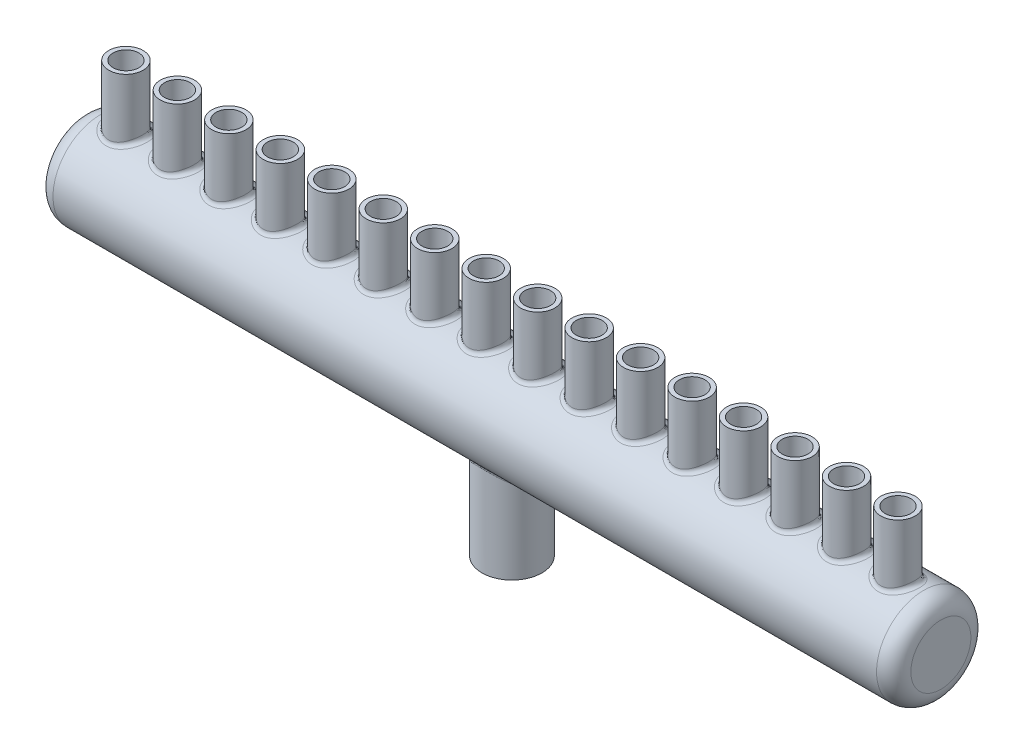
from build123d import *

# Parameters (mm, degrees)
CROQUIS1_R     = 11
EXTRUIR1_DEPTH = 100
CROQUIS2_R     = 7
EXTRUIR2_DEPTH = 30
CROQUIS3_R     = 4
EXTRUIR3_DEPTH = 25
REDONDEO1_R    = 4
REDONDEO2_R    = 1
VACIADO1_T     = -1


with BuildPart() as part:
    # Croquis1 → Extruir1 (new, symmetric)
    with BuildSketch(Plane(origin=(0, 0, 0), x_dir=(0, 0, -1), z_dir=(1, 0, 0))):
        Circle(CROQUIS1_R)
    extrude(amount=EXTRUIR1_DEPTH, both=True)

    # Croquis2 → Extruir2 (add)
    with BuildSketch(Plane(origin=(0, 0, 0), x_dir=(1, 0, 0), z_dir=(0, 1, 0))):
        with Locations(Location((0, 0, 0), (0, 0, 270))):
            Circle(CROQUIS2_R)
    extrude(amount=-EXTRUIR2_DEPTH)

    # Croquis3 → Extruir3 (add)
    with BuildSketch(Plane(origin=(0, 0, 0), x_dir=(1, 0, 0), z_dir=(0, 1, 0))):
        with Locations(Location((-6, 0, 0), (0, 0, 90))):
            Circle(CROQUIS3_R)
        with Locations(Location((-18, 0, 0), (0, 0, 90))):
            Circle(CROQUIS3_R)
        with Locations(Location((-30, 0, 0), (0, 0, 90))):
            Circle(CROQUIS3_R)
        with Locations(Location((-42, 0, 0), (0, 0, 90))):
            Circle(CROQUIS3_R)
        with Locations(Location((-54, 0, 0), (0, 0, 90))):
            Circle(CROQUIS3_R)
        with Locations(Location((-66, 0, 0), (0, 0, 90))):
            Circle(CROQUIS3_R)
        with Locations(Location((-78, 0, 0), (0, 0, 90))):
            Circle(CROQUIS3_R)
        with Locations(Location((-90, 0, 0), (0, 0, 90))):
            Circle(CROQUIS3_R)
        with Locations(Location((90, 0, 0), (0, 0, 90))):
            Circle(CROQUIS3_R)
        with Locations(Location((78, 0, 0), (0, 0, 90))):
            Circle(CROQUIS3_R)
        with Locations(Location((66, 0, 0), (0, 0, 90))):
            Circle(CROQUIS3_R)
        with Locations(Location((54, 0, 0), (0, 0, 90))):
            Circle(CROQUIS3_R)
        with Locations(Location((42, 0, 0), (0, 0, 90))):
            Circle(CROQUIS3_R)
        with Locations(Location((30, 0, 0), (0, 0, 90))):
            Circle(CROQUIS3_R)
        with Locations(Location((18, 0, 0), (0, 0, 90))):
            Circle(CROQUIS3_R)
        with Locations(Location((6, 0, 0), (0, 0, 90))):
            Circle(CROQUIS3_R)
    extrude(amount=EXTRUIR3_DEPTH)

    # Redondeo1
    redondeo1_edges = [part.edges().sort_by_distance(p)[0] for p in [
        (-100, 0, 11),
        (100, 0, 11),
    ]]
    fillet(redondeo1_edges, radius=REDONDEO1_R)

    # Redondeo2
    redondeo2_edges = [part.edges().sort_by_distance(p)[0] for p in [
        (-6, 10.246950766, 4),
        (-18, 10.246950766, 4),
        (-30, 10.246950766, 4),
        (-42, 10.246950766, 4),
        (-54, 10.246950766, 4),
        (-66, 10.246950766, 4),
        (-78, 10.246950766, 4),
        (-90, 10.246950766, 4),
        (90, 10.246950766, 4),
        (78, 10.246950766, 4),
        (66, 10.246950766, 4),
        (54, 10.246950766, 4),
        (42, 10.246950766, 4),
        (30, 10.246950766, 4),
        (18, 10.246950766, 4),
        (6, 10.246950766, 4),
        (0, -8.485281374, -7),
    ]]
    fillet(redondeo2_edges, radius=REDONDEO2_R)

    # Vaciado1
    vaciado1_openings = [part.faces().sort_by_distance(p)[0] for p in [
        (-6, 25, 0),
        (-18, 25, 0),
        (-30, 25, 0),
        (-42, 25, 0),
        (-54, 25, 0),
        (-66, 25, 0),
        (-78, 25, 0),
        (-90, 25, 0),
        (90, 25, 0),
        (78, 25, 0),
        (66, 25, 0),
        (54, 25, 0),
        (42, 25, 0),
        (30, 25, 0),
        (18, 25, 0),
        (6, 25, 0),
        (0, -30, 0),
    ]]
    offset(amount=VACIADO1_T, openings=vaciado1_openings, kind=Kind.INTERSECTION)


solid = part.part
